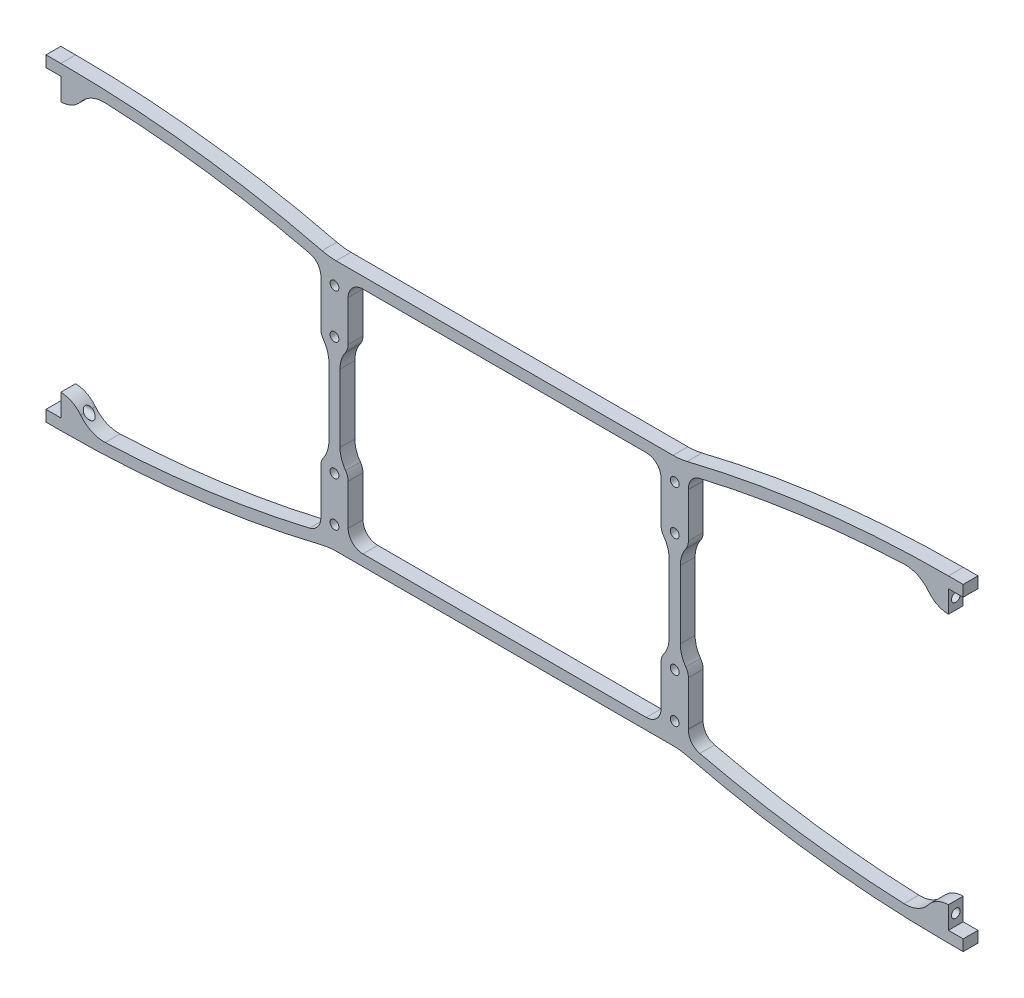
from build123d import *

# Parameters (mm, degrees)
SKETCH1_W                        = 141.2875
SKETCH1_H                        = 98.425
BOSS_EXTRUDE1_DEPTH              = 6.35
SKETCH2_W                        = 6.35
SKETCH2_H                        = 11.90625
BOSS_EXTRUDE2_DEPTH              = 6.35
FILLET1_R                        = 12.7
FILLET2_R                        = 11.1125
F_6_CLEARANCE_HOLE1_D            = 3.7973
BOSS_EXTRUDE3_DEPTH              = 6.35
FILLET6_R                        = 6.35
FILLET7_R                        = 12.7
TAP_DRILL_FOR_6_HELICOIL1_REACH  = 395.37
TAP_DRILL_FOR_6_HELICOIL1_BORE_R = 1.8669
FILLET8_R                        = 25.4


with BuildPart() as part:
    # Sketch1 → Boss-Extrude1 (new body)
    with BuildSketch(Plane.XY):
        with BuildLine():
            Line((-190.5, 68.2625), (-196.85, 68.2625))
            Line((-196.85, 68.2625), (-196.85, 63.5))
            Line((-196.85, 63.5), (-190.5, 63.5))
            ThreePointArc((-190.5, 63.5), (-132.502085729, 59.876365619), (-75.40625, 49.061823171))
            Line((-75.40625, 49.061823171), (-75.40625, -49.061823171))
            ThreePointArc((-75.40625, -49.061823171), (-132.502085729, -59.876365619), (-190.5, -63.5))
            Line((-190.5, -63.5), (-196.85, -63.5))
            Line((-196.85, -63.5), (-196.85, -68.2625))
            Line((-196.85, -68.2625), (-190.5, -68.2625))
            ThreePointArc((-190.5, -68.2625), (-132.511415034, -64.676969168), (-75.40625, -53.975))
            Line((-75.40625, -53.975), (75.40625, -53.975))
            ThreePointArc((75.40625, -53.975), (132.511415034, -64.676969168), (190.5, -68.2625))
            Line((190.5, -68.2625), (196.85, -68.2625))
            Line((196.85, -68.2625), (196.85, -63.5))
            Line((196.85, -63.5), (190.5, -63.5))
            ThreePointArc((190.5, -63.5), (132.502085729, -59.876365619), (75.40625, -49.061823171))
            Line((75.40625, -49.061823171), (75.40625, 49.061823171))
            ThreePointArc((75.40625, 49.061823171), (132.502085729, 59.876365619), (190.5, 63.5))
            Line((190.5, 63.5), (196.85, 63.5))
            Line((196.85, 63.5), (196.85, 68.2625))
            Line((196.85, 68.2625), (190.5, 68.2625))
            ThreePointArc((190.5, 68.2625), (132.511415034, 64.676969168), (75.40625, 53.975))
            Line((75.40625, 53.975), (-75.40625, 53.975))
            ThreePointArc((-75.40625, 53.975), (-132.511415034, 64.676969168), (-190.5, 68.2625))
        make_face()
        Rectangle(SKETCH1_W, SKETCH1_H, mode=Mode.SUBTRACT)
    extrude(amount=BOSS_EXTRUDE1_DEPTH)

    # Sketch2 → Boss-Extrude2 (add)
    with BuildSketch(Plane.XY.offset(6.35)):
        with Locations((-187.325, 59.928125)):
            Rectangle(SKETCH2_W, SKETCH2_H)
        with Locations((-187.325, -59.928125)):
            Rectangle(SKETCH2_W, SKETCH2_H)
        with Locations((187.325, 59.928125)):
            Rectangle(SKETCH2_W, SKETCH2_H)
        with Locations((187.325, -59.928125)):
            Rectangle(SKETCH2_W, SKETCH2_H)
    extrude(amount=-BOSS_EXTRUDE2_DEPTH)

    # Fillet1
    # the kernel refuses this fillet: 12.7 mm, written as the material it adds along each edge
    with BuildSketch(Plane(origin=(184.15, 63.45672917, 6.35), x_dir=(-0.99962806689961, -0.027271374489539257, 0), z_dir=(0, 0, -1)), Plane(origin=(-184.15, -63.45672917, 6.35), x_dir=(0.99962806689961, 0.027271374489539257, 0), z_dir=(0, 0, -1))) as fillet1_piece_1:
        with BuildLine():
            CenterArc((12.543433863, -12.698817502), FILLET1_R, 89.218121226, 76.091724544)
            Line((0.258579787, -9.478202601), (0.012882705, -9.413790303))
            ThreePointArc((0.012882705, -9.413790303), (-0.124615635, -4.746028229), (-0.253905529, -0.006926929))
            Line((-0.253905529, -0.006926929), (-0.003466068, 0.25397635))
            ThreePointArc((-0.003466068, 0.25397635), (6.358368621, 0.297384964), (12.72020331, 0.25397635))
            Line((12.72020331, 0.25397635), (12.716737242, 0))
        make_face()
    extrude(amount=6.35)
    with BuildSketch(Plane(origin=(184.15, -63.45672917, 6.35), x_dir=(-0.9996280668996101, 0.027271374489534914, 0), z_dir=(0, 0, -1)), Plane(origin=(-184.15, 63.45672917, 6.35), x_dir=(0.9996280668996103, -0.027271374489535417, 0), z_dir=(0, 0, -1))) as fillet1_piece_2:
        with BuildLine():
            CenterArc((12.543433863, 12.698817502), FILLET1_R, 194.69015423, 76.091724544)
            Line((0.258579787, 9.478202601), (0.012882705, 9.413790303))
            ThreePointArc((0.012882705, 9.413790303), (-0.124615635, 4.746028229), (-0.253905529, 0.006926929))
            Line((-0.253905529, 0.006926929), (-0.003466068, -0.25397635))
            ThreePointArc((-0.003466068, -0.25397635), (6.358368621, -0.297384964), (12.72020331, -0.25397635))
            Line((12.72020331, -0.25397635), (12.716737242, 0))
        make_face()
    extrude(amount=6.35)

    # Fillet2
    # the kernel refuses this fillet: 11.1125 mm, written as the material it takes off along each edge
    with BuildSketch(Plane(origin=(184.15, 53.975, 22.225), x_dir=(1, 0, 0), z_dir=(0, 0, -1)), Plane(origin=(-184.15, -53.975, 22.225), x_dir=(-1, 0, 0), z_dir=(0, 0, -1))) as fillet2_piece_1:
        with BuildLine():
            CenterArc((6.568650991, -11.110348689), FILLET2_R, 91.127431943, 50.859279282)
            Line((-2.186531495, -4.266779746), (-2.361635145, -4.129908367))
            ThreePointArc((-2.361635145, -4.129908367), (-1.087885719, -2.136146894), (-0.213367951, 0.062202733))
            Line((-0.213367951, 0.062202733), (0, 0.22225))
            ThreePointArc((0, 0.22225), (3.175, 0.22225), (6.34562698, 0.222206974))
            Line((6.34562698, 0.222206974), (6.35, 0))
        make_face()
    extrude(amount=38.1, mode=Mode.SUBTRACT)
    with BuildSketch(Plane(origin=(184.15, -53.975, 22.225), x_dir=(1, 0, 0), z_dir=(0, 0, -1))) as fillet2_piece_2:
        with BuildLine():
            CenterArc((6.568650991, 11.110348689), FILLET2_R, 218.013288775, 50.859279282)
            Line((-2.186531495, 4.266779746), (-2.361635145, 4.129908367))
            ThreePointArc((-2.361635145, 4.129908367), (-1.087885719, 2.136146894), (-0.213367951, -0.062202733))
            Line((-0.213367951, -0.062202733), (0, -0.22225))
            ThreePointArc((0, -0.22225), (3.175, -0.22225), (6.34562698, -0.222206974))
            Line((6.34562698, -0.222206974), (6.35, 0))
        make_face()
    extrude(amount=38.1, mode=Mode.SUBTRACT)
    with BuildSketch(Plane(origin=(-184.15, 53.975, 22.225), x_dir=(0.4560588886616107, 0.8899495997373877, 0), z_dir=(0, 0, -1))) as fillet2_piece_3:
        with BuildLine():
            CenterArc((6.891958698, -10.912741596), FILLET2_R, 100.880203069, 50.859279282)
            Line((-2.895973943, -5.651179958), (-3.091732596, -5.545948726))
            ThreePointArc((-3.091732596, -5.545948726), (-1.64577827, -2.724230891), (-0.197791299, 0.101359088))
            Line((-0.197791299, 0.101359088), (0.041951053, 0.218254832))
            ThreePointArc((0.041951053, 0.218254832), (2.397203025, -0.006045319), (4.752454998, 0.218254832))
            Line((4.752454998, 0.218254832), (4.794406051, 0))
        make_face()
    extrude(amount=38.1, mode=Mode.SUBTRACT)

    # #6 Clearance Hole1 (through all)
    with Locations(Plane.XY.offset(6.35)):
        with Locations((-73.025, 44.45), (-73.025, 25.4), (73.025, 25.4), (73.025, 44.45), (73.025, -44.45), (73.025, -25.4), (-73.025, -25.4), (-73.025, -44.45)):
            Hole(F_6_CLEARANCE_HOLE1_D / 2)

    # Sketch5 → Boss-Extrude3 (add, through all)
    with BuildSketch(Plane.XY.offset(6.35)):
        with BuildLine():
            ThreePointArc((-75.40625, 39.08753497), (-77.944254466, 41.251982137), (-78.8924, 44.45))
            Line((-78.8924, 44.45), (-78.8924, 25.4))
            ThreePointArc((-78.8924, 25.4), (-77.944254466, 28.598017863), (-75.40625, 30.76246503))
            Line((-75.40625, 30.76246503), (-75.40625, 39.08753497))
        make_face()
        with BuildLine():
            ThreePointArc((-76.331861225, 49.296756812), (-78.212921564, 47.190775913), (-78.8924, 44.45))
            ThreePointArc((-78.8924, 44.45), (-77.944254466, 41.251982137), (-75.40625, 39.08753497))
            Line((-75.40625, 39.08753497), (-75.40625, 49.061823171))
            ThreePointArc((-75.40625, 49.061823171), (-75.868995426, 49.179527119), (-76.331861225, 49.296756812))
        make_face()
        with BuildLine():
            ThreePointArc((-67.1576, 44.45), (-67.80319395, 47.125654001), (-69.597905529, 49.2125))
            Line((-69.597905529, 49.2125), (-70.64375, 49.2125))
            Line((-70.64375, 49.2125), (-70.64375, 39.08753497))
            ThreePointArc((-70.64375, 39.08753497), (-68.105745534, 41.251982137), (-67.1576, 44.45))
        make_face()
        with BuildLine():
            ThreePointArc((-67.1576, 44.45), (-68.105745534, 41.251982137), (-70.64375, 39.08753497))
            Line((-70.64375, 39.08753497), (-70.64375, 30.76246503))
            ThreePointArc((-70.64375, 30.76246503), (-68.105745534, 28.598017863), (-67.1576, 25.4))
            Line((-67.1576, 25.4), (-67.1576, 44.45))
        make_face()
        with BuildLine():
            ThreePointArc((-67.1576, 25.4), (-68.105745534, 28.598017863), (-70.64375, 30.76246503))
            Line((-70.64375, 30.76246503), (-70.64375, 20.03753497))
            ThreePointArc((-70.64375, 20.03753497), (-68.105745534, 22.201982137), (-67.1576, 25.4))
        make_face()
        with BuildLine():
            ThreePointArc((-75.40625, 30.76246503), (-77.944254466, 28.598017863), (-78.8924, 25.4))
            ThreePointArc((-78.8924, 25.4), (-77.944254466, 22.201982137), (-75.40625, 20.03753497))
            Line((-75.40625, 20.03753497), (-75.40625, 30.76246503))
        make_face()
        with BuildLine():
            Line((-75.40625, -30.76246503), (-75.40625, -20.03753497))
            ThreePointArc((-75.40625, -20.03753497), (-77.944254466, -22.201982137), (-78.8924, -25.4))
            ThreePointArc((-78.8924, -25.4), (-77.944254466, -28.598017863), (-75.40625, -30.76246503))
        make_face()
        with BuildLine():
            ThreePointArc((-75.40625, -30.76246503), (-77.944254466, -28.598017863), (-78.8924, -25.4))
            Line((-78.8924, -25.4), (-78.8924, -44.45))
            ThreePointArc((-78.8924, -44.45), (-77.944254466, -41.251982137), (-75.40625, -39.08753497))
            Line((-75.40625, -39.08753497), (-75.40625, -30.76246503))
        make_face()
        with BuildLine():
            ThreePointArc((-75.40625, -39.08753497), (-77.944254466, -41.251982137), (-78.8924, -44.45))
            ThreePointArc((-78.8924, -44.45), (-78.212921564, -47.190775913), (-76.331861225, -49.296756812))
            ThreePointArc((-76.331861225, -49.296756812), (-75.868995426, -49.179527119), (-75.40625, -49.061823171))
            Line((-75.40625, -49.061823171), (-75.40625, -39.08753497))
        make_face()
        with BuildLine():
            Line((-67.1576, -44.45), (-67.1576, -25.4))
            ThreePointArc((-67.1576, -25.4), (-68.105745534, -28.598017863), (-70.64375, -30.76246503))
            Line((-70.64375, -30.76246503), (-70.64375, -39.08753497))
            ThreePointArc((-70.64375, -39.08753497), (-68.105745534, -41.251982137), (-67.1576, -44.45))
        make_face()
        with BuildLine():
            ThreePointArc((-67.1576, -25.4), (-68.105745534, -22.201982137), (-70.64375, -20.03753497))
            Line((-70.64375, -20.03753497), (-70.64375, -30.76246503))
            ThreePointArc((-70.64375, -30.76246503), (-68.105745534, -28.598017863), (-67.1576, -25.4))
        make_face()
        with BuildLine():
            ThreePointArc((-69.597905529, -49.2125), (-67.80319395, -47.125654001), (-67.1576, -44.45))
            ThreePointArc((-67.1576, -44.45), (-68.105745534, -41.251982137), (-70.64375, -39.08753497))
            Line((-70.64375, -39.08753497), (-70.64375, -49.2125))
            Line((-70.64375, -49.2125), (-69.597905529, -49.2125))
        make_face()
        with BuildLine():
            Line((70.64375, -30.76246503), (70.64375, -20.03753497))
            ThreePointArc((70.64375, -20.03753497), (68.105745534, -22.201982137), (67.1576, -25.4))
            ThreePointArc((67.1576, -25.4), (68.105745534, -28.598017863), (70.64375, -30.76246503))
        make_face()
        with BuildLine():
            ThreePointArc((70.64375, -30.76246503), (68.105745534, -28.598017863), (67.1576, -25.4))
            Line((67.1576, -25.4), (67.1576, -44.45))
            ThreePointArc((67.1576, -44.45), (68.105745534, -41.251982137), (70.64375, -39.08753497))
            Line((70.64375, -39.08753497), (70.64375, -30.76246503))
        make_face()
        with BuildLine():
            ThreePointArc((67.1576, -44.45), (67.80319395, -47.125654001), (69.597905529, -49.2125))
            Line((69.597905529, -49.2125), (70.64375, -49.2125))
            Line((70.64375, -49.2125), (70.64375, -39.08753497))
            ThreePointArc((70.64375, -39.08753497), (68.105745534, -41.251982137), (67.1576, -44.45))
        make_face()
        with BuildLine():
            ThreePointArc((75.40625, -49.061823171), (75.868995426, -49.179527119), (76.331861225, -49.296756812))
            ThreePointArc((76.331861225, -49.296756812), (78.212921564, -47.190775913), (78.8924, -44.45))
            ThreePointArc((78.8924, -44.45), (77.944254466, -41.251982137), (75.40625, -39.08753497))
            Line((75.40625, -39.08753497), (75.40625, -49.061823171))
        make_face()
        with BuildLine():
            Line((78.8924, -44.45), (78.8924, -25.4))
            ThreePointArc((78.8924, -25.4), (77.944254466, -28.598017863), (75.40625, -30.76246503))
            Line((75.40625, -30.76246503), (75.40625, -39.08753497))
            ThreePointArc((75.40625, -39.08753497), (77.944254466, -41.251982137), (78.8924, -44.45))
        make_face()
        with BuildLine():
            ThreePointArc((78.8924, -25.4), (77.944254466, -22.201982137), (75.40625, -20.03753497))
            Line((75.40625, -20.03753497), (75.40625, -30.76246503))
            ThreePointArc((75.40625, -30.76246503), (77.944254466, -28.598017863), (78.8924, -25.4))
        make_face()
        with BuildLine():
            Line((78.8924, 25.4), (78.8924, 44.45))
            ThreePointArc((78.8924, 44.45), (77.944254466, 41.251982137), (75.40625, 39.08753497))
            Line((75.40625, 39.08753497), (75.40625, 30.76246503))
            ThreePointArc((75.40625, 30.76246503), (77.944254466, 28.598017863), (78.8924, 25.4))
        make_face()
        with BuildLine():
            ThreePointArc((78.8924, 44.45), (78.212921564, 47.190775913), (76.331861225, 49.296756812))
            ThreePointArc((76.331861225, 49.296756812), (75.868995426, 49.179527119), (75.40625, 49.061823171))
            Line((75.40625, 49.061823171), (75.40625, 39.08753497))
            ThreePointArc((75.40625, 39.08753497), (77.944254466, 41.251982137), (78.8924, 44.45))
        make_face()
        with BuildLine():
            Line((70.64375, 49.2125), (69.597905529, 49.2125))
            ThreePointArc((69.597905529, 49.2125), (67.80319395, 47.125654001), (67.1576, 44.45))
            ThreePointArc((67.1576, 44.45), (68.105745534, 41.251982137), (70.64375, 39.08753497))
            Line((70.64375, 39.08753497), (70.64375, 49.2125))
        make_face()
        with BuildLine():
            ThreePointArc((70.64375, 39.08753497), (68.105745534, 41.251982137), (67.1576, 44.45))
            Line((67.1576, 44.45), (67.1576, 25.4))
            ThreePointArc((67.1576, 25.4), (68.105745534, 28.598017863), (70.64375, 30.76246503))
            Line((70.64375, 30.76246503), (70.64375, 39.08753497))
        make_face()
        with BuildLine():
            ThreePointArc((70.64375, 30.76246503), (68.105745534, 28.598017863), (67.1576, 25.4))
            ThreePointArc((67.1576, 25.4), (68.105745534, 22.201982137), (70.64375, 20.03753497))
            Line((70.64375, 20.03753497), (70.64375, 30.76246503))
        make_face()
        with BuildLine():
            ThreePointArc((75.40625, 20.03753497), (77.944254466, 22.201982137), (78.8924, 25.4))
            ThreePointArc((78.8924, 25.4), (77.944254466, 28.598017863), (75.40625, 30.76246503))
            Line((75.40625, 30.76246503), (75.40625, 20.03753497))
        make_face()
    extrude(amount=-BOSS_EXTRUDE3_DEPTH)

    # Fillet6
    fillet6_edges = [part.edges().sort_by_distance(p)[0] for p in [
        (76.331861225, 49.296756812, 3.175),
        (69.597905529, 49.2125, 3.175),
        (76.331861225, -49.296756812, 3.175),
        (69.597905529, -49.2125, 3.175),
        (-69.597905529, -49.2125, 3.175),
        (-76.331861225, -49.296756812, 3.175),
        (-69.597905529, 49.2125, 3.175),
        (-76.331861225, 49.296756812, 3.175),
    ]]
    fillet(fillet6_edges, radius=FILLET6_R)

    # Fillet7
    fillet7_edges = [part.edges().sort_by_distance(p)[0] for p in [
        (-70.64375, 20.03753497, 3.175),
        (-75.40625, 20.03753497, 3.175),
        (-75.40625, -20.03753497, 3.175),
        (-70.64375, -20.03753497, 3.175),
        (70.64375, -20.03753497, 3.175),
        (75.40625, -20.03753497, 3.175),
        (70.64375, 20.03753497, 3.175),
        (75.40625, 20.03753497, 3.175),
    ]]
    fillet(fillet7_edges, radius=FILLET7_R)

    # Tap Drill for #6 Helicoil1 bore → Tap Drill for #6 Helicoil1 (cut, up to next)
    with BuildSketch(Plane(origin=(190.5, 0, 0), x_dir=(0, 0, -1), z_dir=(1, 0, 0)), mode=Mode.PRIVATE) as tap_drill_for_6_helicoil1_sk1:
        with Locations((-3.175, 58.7375)):
            Circle(TAP_DRILL_FOR_6_HELICOIL1_BORE_R)
    tap_drill_for_6_helicoil1_tool1 = extrude(tap_drill_for_6_helicoil1_sk1.sketch, amount=-TAP_DRILL_FOR_6_HELICOIL1_REACH, mode=Mode.PRIVATE) & part.part
    # Tap Drill for #6 Helicoil1 bore → Tap Drill for #6 Helicoil1 (cut, up to next)
    with BuildSketch(Plane(origin=(190.5, 0, 0), x_dir=(0, 0, -1), z_dir=(1, 0, 0)), mode=Mode.PRIVATE) as tap_drill_for_6_helicoil1_sk2:
        with Locations((-3.175, -58.7375)):
            Circle(TAP_DRILL_FOR_6_HELICOIL1_BORE_R)
    tap_drill_for_6_helicoil1_tool2 = extrude(tap_drill_for_6_helicoil1_sk2.sketch, amount=-TAP_DRILL_FOR_6_HELICOIL1_REACH, mode=Mode.PRIVATE) & part.part
    tap_drill_for_6_helicoil1_1 = tap_drill_for_6_helicoil1_tool1.solids().sort_by_distance((190.5, 58.7375, 3.175))[0]
    add(tap_drill_for_6_helicoil1_1, mode=Mode.SUBTRACT)
    tap_drill_for_6_helicoil1_2 = tap_drill_for_6_helicoil1_tool2.solids().sort_by_distance((190.5, -58.7375, 3.175))[0]
    add(tap_drill_for_6_helicoil1_2, mode=Mode.SUBTRACT)
    tap_drill_for_6_helicoil1 = tap_drill_for_6_helicoil1_1 + tap_drill_for_6_helicoil1_2  # Tap Drill for #6 Helicoil1 as one shape, for the pattern or mirror that repeats it

    # Mirror1: Tap Drill for #6 Helicoil1 across plane
    add(tap_drill_for_6_helicoil1.mirror(Plane(origin=(0, 0, 0), x_dir=(0, 0, 1), z_dir=(1, 0, 0))), mode=Mode.SUBTRACT)

    # Fillet8
    fillet8_edges = [part.edges().sort_by_distance(p)[0] for p in [
        (-75.40625, 53.975, 3.175),
        (75.40625, 53.975, 3.175),
        (75.40625, -53.975, 3.175),
        (-75.40625, -53.975, 3.175),
    ]]
    fillet(fillet8_edges, radius=FILLET8_R)


solid = part.part
